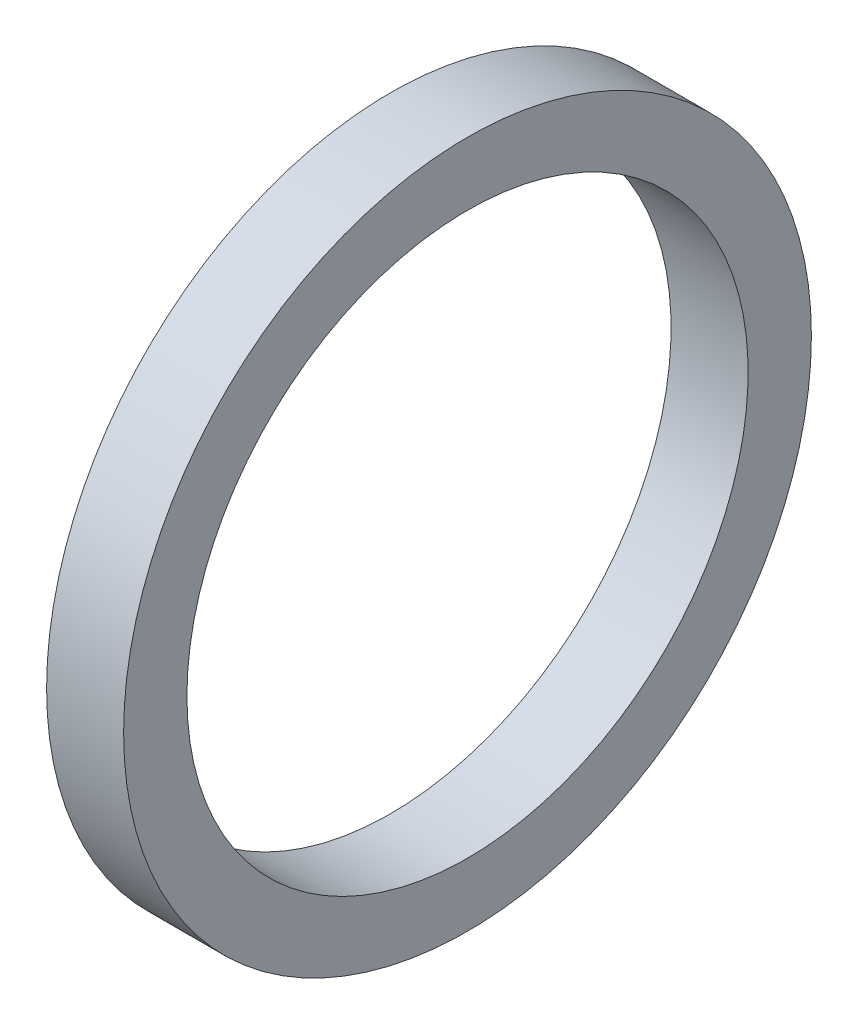
from build123d import *

# Parameters (mm, degrees)
SKETCH1_W = 14
SKETCH1_H = 11.5


with BuildPart() as part:
    # Sketch1 → Base-Revolve (revolve)
    with BuildSketch(Plane.XY):
        with Locations((-7, 56.75)):
            Rectangle(SKETCH1_W, SKETCH1_H)
    revolve(axis=Axis((-34.925, 0, 0), (1, 0, 0)))


solid = part.part
